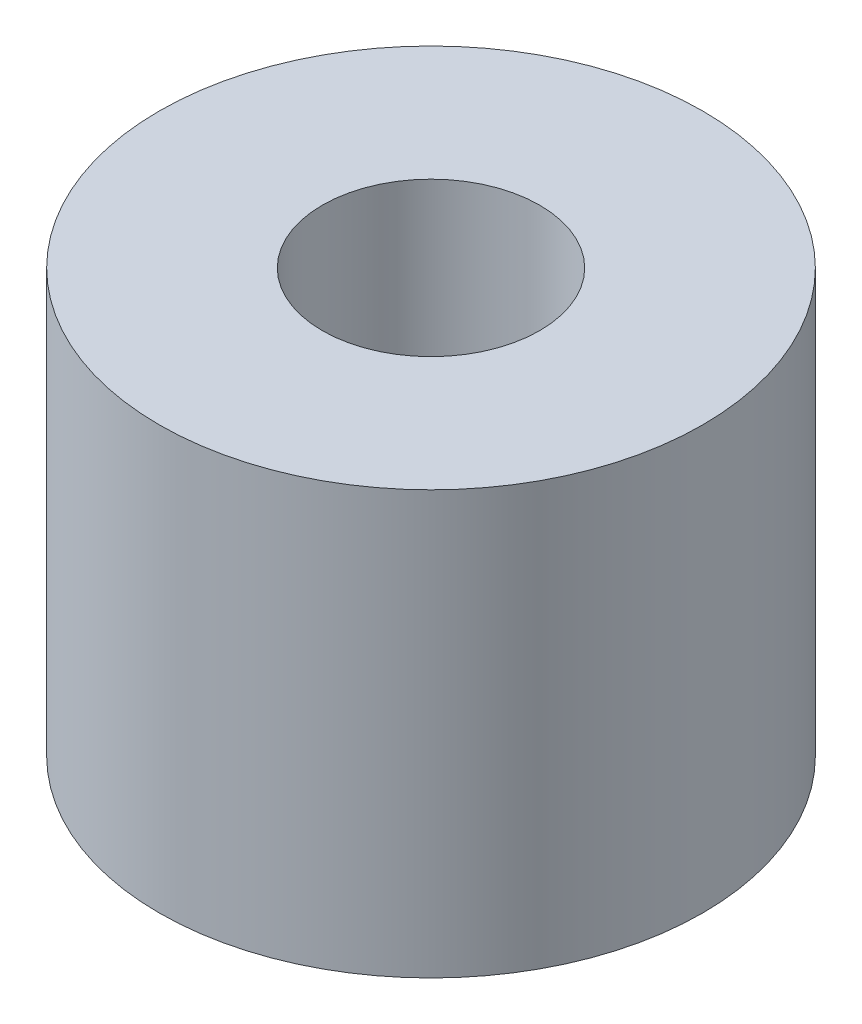
from build123d import *

# Parameters (mm, degrees)
CROQUIS1_R              = 4.5
CROQUIS1_R_2            = 1.8
SALIENTE_EXTRUIR1_DEPTH = 7


with BuildPart() as part:
    # Croquis1 → Saliente-Extruir1 (new body)
    with BuildSketch(Plane(origin=(0, 0, 0), x_dir=(1, 0, 0), z_dir=(0, 1, 0))):
        Circle(CROQUIS1_R)
        Circle(CROQUIS1_R_2, mode=Mode.SUBTRACT)
    extrude(amount=SALIENTE_EXTRUIR1_DEPTH)


solid = part.part
